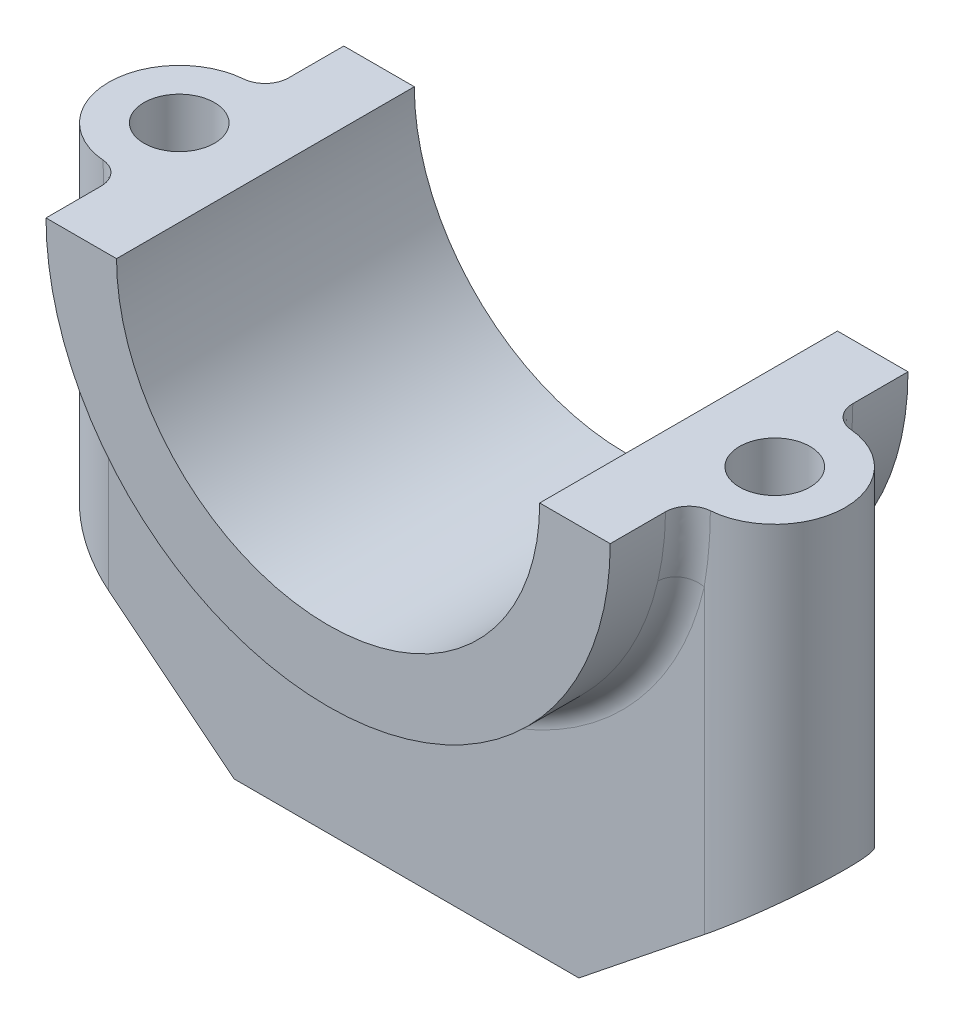
from build123d import *

# Parameters (mm, degrees)
BOSS_EXTRUDE1_DEPTH    = 19
BOSS_EXTRUDE2_DEPTH    = 9
FILLET1_START          = -60
FILLET1_DEPTH          = 60
FILLET2_START          = -60
FILLET2_DEPTH          = 60
M10X1_5_TAPPED_HOLE1_D = 9
FILLET3_R              = 3


with BuildPart() as part:
    # Sketch1 → Boss-Extrude1 (new, symmetric)
    with BuildSketch(Plane.XY):
        with BuildLine():
            Line((-27, 0), (-36, 0))
            ThreePointArc((-36, 0), (0, -36), (36, 0))
            Line((36, 0), (27, 0))
            ThreePointArc((27, 0), (0, -27), (-27, 0))
        make_face()
    extrude(amount=BOSS_EXTRUDE1_DEPTH, both=True)

    # Sketch1<3> → Boss-Extrude2 (add, symmetric)
    with BuildSketch(Plane.XY):
        with BuildLine():
            Line((-36, 0), (-47, 0))
            Line((-47, 0), (-47, -40))
            Line((-47, -40), (-22, -60))
            Line((-22, -60), (22, -60))
            Line((22, -60), (47, -40))
            Line((47, -40), (47, 0))
            Line((47, 0), (36, 0))
            ThreePointArc((36, 0), (0, -36), (-36, 0))
        make_face()
    extrude(amount=BOSS_EXTRUDE2_DEPTH, both=True)

    # Fillet1: read off the stored shape, not the designer's step
    # Fillet1 outline → Fillet1 (cut)
    with BuildSketch(Plane(origin=(0, 0, 0), x_dir=(1, 0, 0), z_dir=(0, 1, 0)).offset(FILLET1_START)):
        with BuildLine():
            Line((47, 9), (38, 9))
            ThreePointArc((38, 9), (44.363961031, 6.363961031), (47, 0))
            Line((47, 0), (47, 9))
        make_face()
        with BuildLine():
            Line((47, -9), (47, 0))
            ThreePointArc((47, 0), (44.363961031, -6.363961031), (38, -9))
            Line((38, -9), (47, -9))
        make_face()
    extrude(amount=FILLET1_DEPTH, mode=Mode.SUBTRACT)

    # Fillet2: read off the stored shape, not the designer's step
    # Fillet2 outline → Fillet2 (cut)
    with BuildSketch(Plane(origin=(0, 0, 0), x_dir=(1, 0, 0), z_dir=(0, 1, 0)).offset(FILLET2_START)):
        with BuildLine():
            Line((-47, -9), (-38, -9))
            ThreePointArc((-38, -9), (-44.363961031, -6.363961031), (-47, 0))
            Line((-47, 0), (-47, -9))
        make_face()
        with BuildLine():
            Line((-47, 9), (-47, 0))
            ThreePointArc((-47, 0), (-44.363961031, 6.363961031), (-38, 9))
            Line((-38, 9), (-47, 9))
        make_face()
    extrude(amount=FILLET2_DEPTH, mode=Mode.SUBTRACT)

    # M10x1.5 Tapped Hole1 (through all)
    with Locations(Plane(origin=(-38, 0, 0), x_dir=(0, 0, 1), z_dir=(0, 1, 0))):
        with Locations((0, 0), (0, 76)):
            Hole(M10X1_5_TAPPED_HOLE1_D / 2)

    # Fillet3
    fillet3_edges = [part.edges().sort_by_distance(p)[0] for p in [
        (0, -36, -9),
        (0, -36, 9),
    ]]
    fillet(fillet3_edges, radius=FILLET3_R)


solid = part.part
